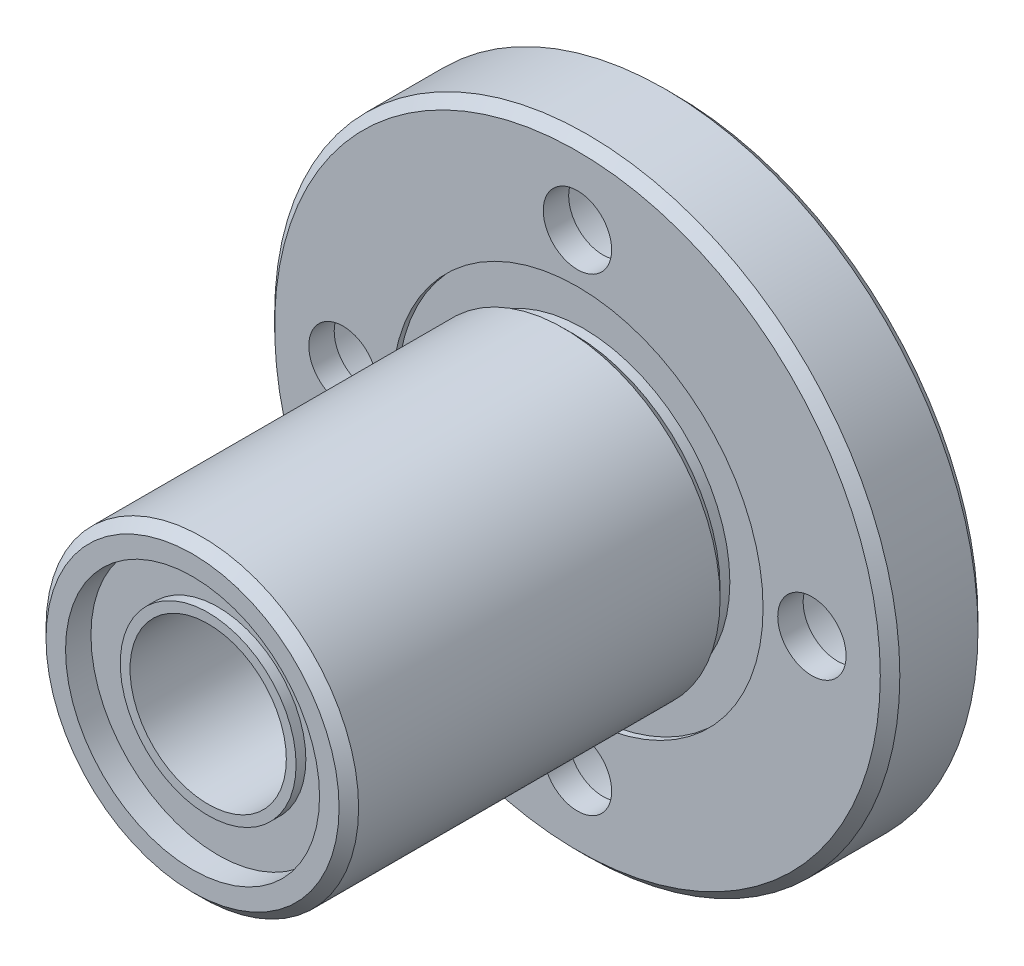
from build123d import *

# Parameters (mm, degrees)
IZIM1_R                     = 16
Y_KSEKLIK_EKSTR_ZYON1_DEPTH = 5
IZIM2_R                     = 8
Y_KSEKLIK_EKSTR_ZYON2_DEPTH = 19.7
KES_EKSTR_ZYON1_REACH       = 35.498
IZIM3_R                     = 4
KES_EKSTR_ZYON2_REACH       = 35.498
IZIM4_R                     = 1.75
IZIM4_3_R                   = 3.25
IZIM4_3_R_2                 = 1.75
KES_EKSTR_ZYON3_DEPTH       = 3.7
IZIM5_R                     = 6.5
KES_EKSTR_ZYON4_DEPTH       = 1.3
KES_EKSTR_ZYON5_START       = -23.4
IZIM5_2_R                   = 6.5
KES_EKSTR_ZYON5_DEPTH       = 1.3
KES_EKSTR_ZYON7_START       = -0.3
IZIM7_R                     = 9.5
IZIM7_R_2                   = 8
KES_EKSTR_ZYON7_DEPTH       = 0.3
IZIM8_R                     = 8
IZIM8_R_2                   = 7.5
KES_EKSTR_ZYON8_DEPTH       = 1
PAH1_SIZE                   = 0.5
Y_KSEKLIK_EKSTR_ZYON3_START = 0.5
IZIM9_R                     = 4.5
IZIM9_R_2                   = 4
Y_KSEKLIK_EKSTR_ZYON3_DEPTH = 0.5
Y_KSEKLIK_EKSTR_ZYON4_START = -22.1
IZIM9_2_R                   = 4.5
IZIM9_2_R_2                 = 4
Y_KSEKLIK_EKSTR_ZYON4_DEPTH = 0.5
PAH2_SIZE                   = 0.5


with BuildPart() as part:
    # Çizim1 → Yükseklik-Ekstrüzyon1 (new body)
    with BuildSketch(Plane.XY):
        Circle(IZIM1_R)
    extrude(amount=Y_KSEKLIK_EKSTR_ZYON1_DEPTH)

    # Çizim2 → Yükseklik-Ekstrüzyon2 (add)
    with BuildSketch(Plane.XY.offset(5)):
        Circle(IZIM2_R)
    extrude(amount=Y_KSEKLIK_EKSTR_ZYON2_DEPTH)

    # Çizim3 → Kes-Ekstrüzyon1 (cut, up to next)
    with BuildSketch(Plane.XY.offset(24.7), mode=Mode.PRIVATE) as kes_ekstr_zyon1_sk1:
        Circle(IZIM3_R)
    kes_ekstr_zyon1_tool1 = extrude(kes_ekstr_zyon1_sk1.sketch, amount=-KES_EKSTR_ZYON1_REACH, mode=Mode.PRIVATE) & part.part
    add(kes_ekstr_zyon1_tool1.solids().sort_by_distance((0, 0, 24.7))[0], mode=Mode.SUBTRACT)

    # Çizim4 → Kes-Ekstrüzyon2 (cut, up to next)
    with BuildSketch(Plane(origin=(0, 0, 0), x_dir=(-1, 0, 0), z_dir=(0, 0, -1)), mode=Mode.PRIVATE) as kes_ekstr_zyon2_sk1:
        with Locations((0, 12)):
            Circle(IZIM4_R)
    kes_ekstr_zyon2_tool1 = extrude(kes_ekstr_zyon2_sk1.sketch, amount=-KES_EKSTR_ZYON2_REACH, mode=Mode.PRIVATE) & part.part
    # Çizim4 → Kes-Ekstrüzyon2 (cut, up to next)
    with BuildSketch(Plane(origin=(0, 0, 0), x_dir=(-1, 0, 0), z_dir=(0, 0, -1)), mode=Mode.PRIVATE) as kes_ekstr_zyon2_sk2:
        with Locations((12, 0)):
            Circle(IZIM4_R)
    kes_ekstr_zyon2_tool2 = extrude(kes_ekstr_zyon2_sk2.sketch, amount=-KES_EKSTR_ZYON2_REACH, mode=Mode.PRIVATE) & part.part
    # Çizim4 → Kes-Ekstrüzyon2 (cut, up to next)
    with BuildSketch(Plane(origin=(0, 0, 0), x_dir=(-1, 0, 0), z_dir=(0, 0, -1)), mode=Mode.PRIVATE) as kes_ekstr_zyon2_sk3:
        with Locations((0, -12)):
            Circle(IZIM4_R)
    kes_ekstr_zyon2_tool3 = extrude(kes_ekstr_zyon2_sk3.sketch, amount=-KES_EKSTR_ZYON2_REACH, mode=Mode.PRIVATE) & part.part
    # Çizim4 → Kes-Ekstrüzyon2 (cut, up to next)
    with BuildSketch(Plane(origin=(0, 0, 0), x_dir=(-1, 0, 0), z_dir=(0, 0, -1)), mode=Mode.PRIVATE) as kes_ekstr_zyon2_sk4:
        with Locations((-12, 0)):
            Circle(IZIM4_R)
    kes_ekstr_zyon2_tool4 = extrude(kes_ekstr_zyon2_sk4.sketch, amount=-KES_EKSTR_ZYON2_REACH, mode=Mode.PRIVATE) & part.part
    add(kes_ekstr_zyon2_tool1.solids().sort_by_distance((0, 12, 0))[0], mode=Mode.SUBTRACT)
    add(kes_ekstr_zyon2_tool2.solids().sort_by_distance((-12, 0, 0))[0], mode=Mode.SUBTRACT)
    add(kes_ekstr_zyon2_tool3.solids().sort_by_distance((0, -12, 0))[0], mode=Mode.SUBTRACT)
    add(kes_ekstr_zyon2_tool4.solids().sort_by_distance((12, 0, 0))[0], mode=Mode.SUBTRACT)

    # Çizim4<3> → Kes-Ekstrüzyon3 (cut)
    # profile 1 of 4: a face of its own
    with BuildSketch(Plane(origin=(0, 0, 0), x_dir=(-1, 0, 0), z_dir=(0, 0, -1))):
        with Locations((0, 12)):
            Circle(IZIM4_3_R)
        with Locations((0, 12)):
            Circle(IZIM4_3_R_2, mode=Mode.SUBTRACT)
    # profile 2 of 4: a face of its own
    with BuildSketch(Plane(origin=(0, 0, 0), x_dir=(-1, 0, 0), z_dir=(0, 0, -1))):
        with Locations((12, 0)):
            Circle(IZIM4_3_R)
        with Locations((12, 0)):
            Circle(IZIM4_3_R_2, mode=Mode.SUBTRACT)
    # profile 3 of 4: a face of its own
    with BuildSketch(Plane(origin=(0, 0, 0), x_dir=(-1, 0, 0), z_dir=(0, 0, -1))):
        with Locations((0, -12)):
            Circle(IZIM4_3_R)
        with Locations((0, -12)):
            Circle(IZIM4_3_R_2, mode=Mode.SUBTRACT)
    # profile 4 of 4: a face of its own
    with BuildSketch(Plane(origin=(0, 0, 0), x_dir=(-1, 0, 0), z_dir=(0, 0, -1))):
        with Locations((-12, 0)):
            Circle(IZIM4_3_R)
        with Locations((-12, 0)):
            Circle(IZIM4_3_R_2, mode=Mode.SUBTRACT)
    extrude(amount=-KES_EKSTR_ZYON3_DEPTH, mode=Mode.SUBTRACT)

    # Çizim5 → Kes-Ekstrüzyon4 (cut)
    with BuildSketch(Plane.XY.offset(24.7)):
        Circle(IZIM5_R)
    extrude(amount=-KES_EKSTR_ZYON4_DEPTH, mode=Mode.SUBTRACT)

    # Çizim5<2> → Kes-Ekstrüzyon5 (cut)
    with BuildSketch(Plane.XY.offset(24.7).offset(KES_EKSTR_ZYON5_START)):
        Circle(IZIM5_2_R)
    extrude(amount=-KES_EKSTR_ZYON5_DEPTH, mode=Mode.SUBTRACT)

    # Çizim7 → Kes-Ekstrüzyon7 (cut)
    with BuildSketch(Plane.XY.offset(5).offset(KES_EKSTR_ZYON7_START)):
        Circle(IZIM7_R)
        Circle(IZIM7_R_2, mode=Mode.SUBTRACT)
    extrude(amount=KES_EKSTR_ZYON7_DEPTH, mode=Mode.SUBTRACT)

    # Çizim8 → Kes-Ekstrüzyon8 (cut)
    with BuildSketch(Plane.XY.offset(4.7)):
        Circle(IZIM8_R)
        Circle(IZIM8_R_2, mode=Mode.SUBTRACT)
    extrude(amount=KES_EKSTR_ZYON8_DEPTH, mode=Mode.SUBTRACT)

    # Pah1
    pah1_edges = [part.edges().sort_by_distance(p)[0] for p in [
        (-7.5, 0, 5.7),
    ]]
    chamfer(pah1_edges, length=PAH1_SIZE - 0.0001)  # a hair under: the kernel refuses the full size

    # Çizim9 → Yükseklik-Ekstrüzyon3 (add)
    with BuildSketch(Plane.XY.offset(23.4).offset(Y_KSEKLIK_EKSTR_ZYON3_START)):
        Circle(IZIM9_R)
        Circle(IZIM9_R_2, mode=Mode.SUBTRACT)
    extrude(amount=-Y_KSEKLIK_EKSTR_ZYON3_DEPTH)

    # Çizim9<2> → Yükseklik-Ekstrüzyon4 (add)
    with BuildSketch(Plane.XY.offset(23.4).offset(Y_KSEKLIK_EKSTR_ZYON4_START)):
        Circle(IZIM9_2_R)
        Circle(IZIM9_2_R_2, mode=Mode.SUBTRACT)
    extrude(amount=-Y_KSEKLIK_EKSTR_ZYON4_DEPTH)

    # Pah2
    pah2_edges = [part.edges().sort_by_distance(p)[0] for p in [
        (-16, 0, 0),
        (-16, 0, 5),
        (-8, 0, 24.7),
    ]]
    chamfer(pah2_edges, length=PAH2_SIZE)


solid = part.part
